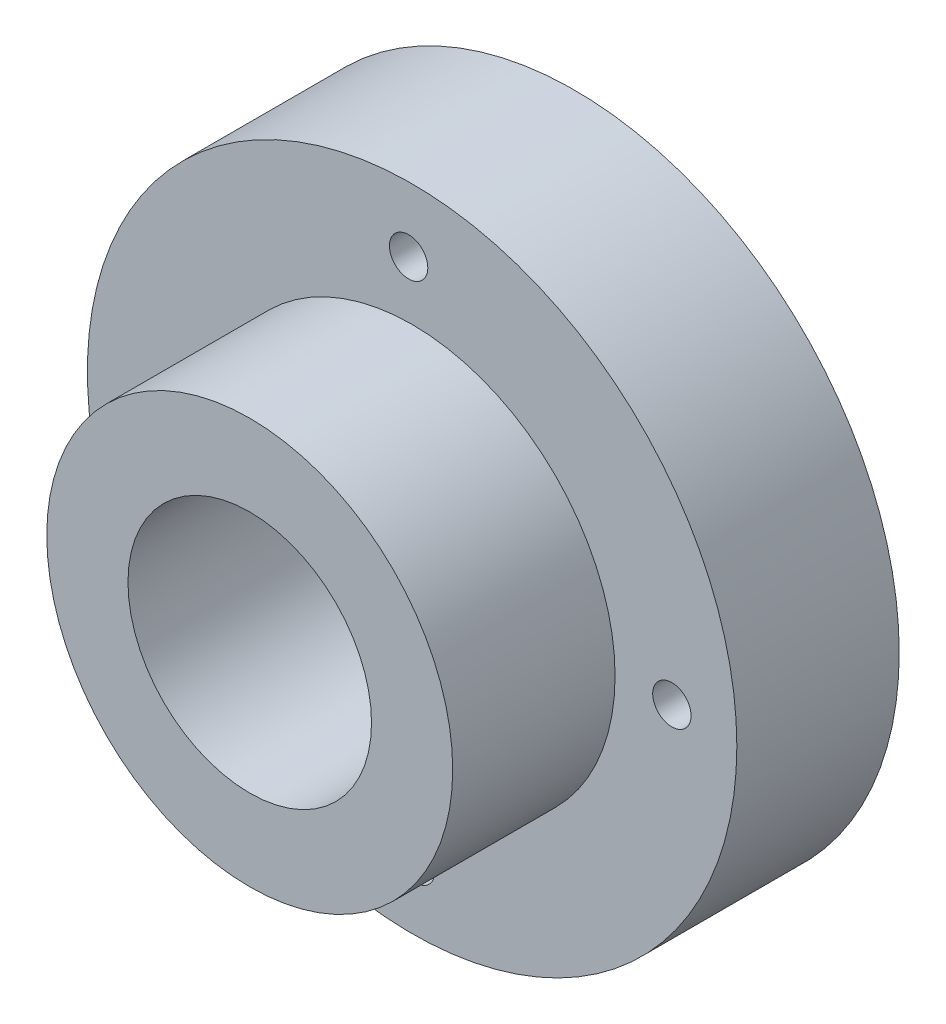
from build123d import *

# Parameters (mm, degrees)
SKETCH1_R                  = 25.4
BOSS_EXTRUDE1_DEPTH        = 25.4
CUT_EXTRUDE1_START         = -12.7
SKETCH2_R                  = 25.4
SKETCH2_R_2                = 15.875
CUT_EXTRUDE1_DEPTH         = 12.7
F_3_4_0_7500_DOWEL_HOLE1_D = 19.05
F_3_0MM_DOWEL_HOLE1_D      = 3
CRVPATTERN1_OUTLINE_R      = 1.5
CRVPATTERN1_DEPTH          = 12.7


# Read off the part's stored shape, not the designer's step: CrvPattern1
with BuildPart() as part:
    # Sketch1 → Boss-Extrude1 (new body)
    with BuildSketch(Plane.XY):
        Circle(SKETCH1_R)
    extrude(amount=BOSS_EXTRUDE1_DEPTH)

    # Sketch2 → Cut-Extrude1 (cut)
    with BuildSketch(Plane.XY.offset(25.4).offset(CUT_EXTRUDE1_START)):
        Circle(SKETCH2_R)
        Circle(SKETCH2_R_2, mode=Mode.SUBTRACT)
    extrude(amount=CUT_EXTRUDE1_DEPTH, mode=Mode.SUBTRACT)

    # 3/4 (0.7500) Dowel Hole1 (through all)
    with Locations(Plane.XY.offset(25.4)):
        with Locations((0, 0)):
            Hole(F_3_4_0_7500_DOWEL_HOLE1_D / 2)

    # Ø3.0mm Dowel Hole1 (through all)
    with Locations(Plane(origin=(-0.272270363, 20.318175825, 12.7), x_dir=(1, 0, 0), z_dir=(0, 0, 1))):
        with Locations((0, 0)):
            Hole(F_3_0MM_DOWEL_HOLE1_D / 2)

    # CrvPattern1 outline → CrvPattern1 (cut)
    with BuildSketch(Plane.XY):
        with Locations((-20.318175825, -0.272270363)):
            Circle(CRVPATTERN1_OUTLINE_R)
        with Locations((0.272270363, -20.318175825)):
            Circle(CRVPATTERN1_OUTLINE_R)
        with Locations((20.318175825, 0.272270363)):
            Circle(CRVPATTERN1_OUTLINE_R)
    extrude(amount=CRVPATTERN1_DEPTH, mode=Mode.SUBTRACT)


solid = part.part
